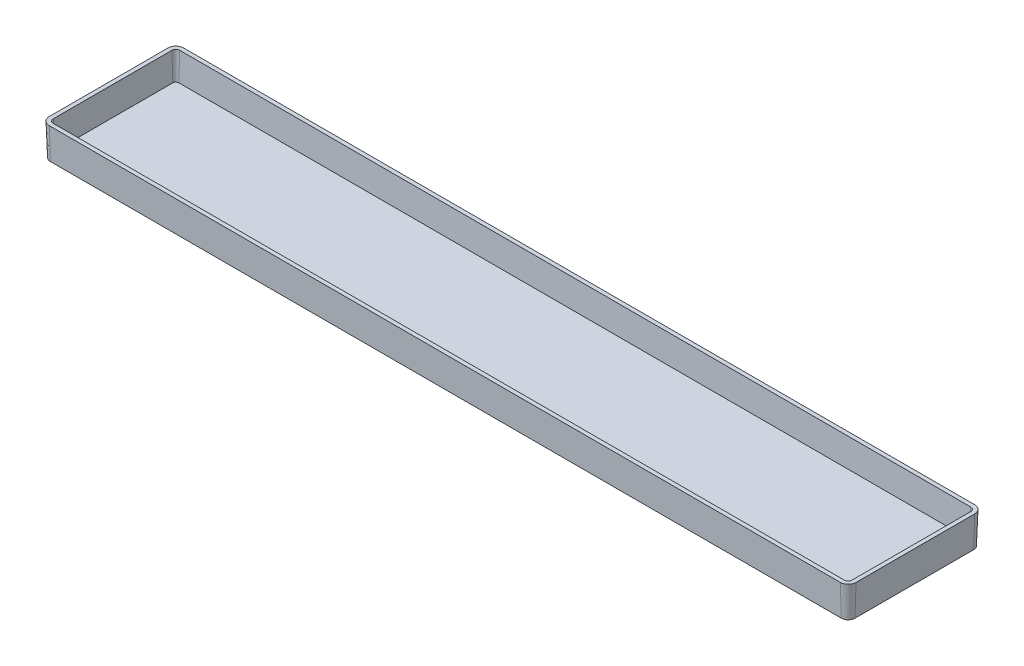
from build123d import *

# Parameters (mm, degrees)
BOSS_EXTRUDE1_DEPTH = 4
BOSS_EXTRUDE1_DRAFT = -2
SHELL1_T            = -0.5


with BuildPart() as part:
    # Sketch1 → Boss-Extrude1 (with draft: the straight prism first)
    with BuildSketch(Plane(origin=(0, 0, 0), x_dir=(1, 0, 0), z_dir=(0, 1, 0))):
        with BuildLine():
            Line((-50, -8.5), (50, -8.5))
            ThreePointArc((50, -8.5), (50.707106781, -8.207106781), (51, -7.5))
            Line((51, -7.5), (51, 7.5))
            ThreePointArc((51, 7.5), (50.707106781, 8.207106781), (50, 8.5))
            Line((50, 8.5), (-50, 8.5))
            ThreePointArc((-50, 8.5), (-50.707106781, 8.207106781), (-51, 7.5))
            Line((-51, 7.5), (-51, -7.5))
            ThreePointArc((-51, -7.5), (-50.707106781, -8.207106781), (-50, -8.5))
        make_face()
    extrude(amount=-BOSS_EXTRUDE1_DEPTH)
    # Boss-Extrude1: the draft: its side faces are tilted about the plane it starts from
    boss_extrude1_sides = [part.faces().sort_by_distance(p)[0] for p in [
        (0, -2, 8.5),
        (50.707106781, -2, 8.207106781),
        (51, -2, 0),
        (50.707106781, -2, -8.207106781),
        (0, -2, -8.5),
        (-50.707106781, -2, -8.207106781),
        (-51, -2, 0),
        (-50.707106781, -2, 8.207106781),
    ]]
    draft(boss_extrude1_sides, Plane(origin=(0, 0, 0), x_dir=(1, 0, 0), z_dir=(0, 1, 0)), BOSS_EXTRUDE1_DRAFT)

    # Shell1
    shell1_openings = [part.faces().sort_by_distance(p)[0] for p in [
        (0, 0, 0),
    ]]
    offset(amount=SHELL1_T, openings=shell1_openings, kind=Kind.INTERSECTION)


solid = part.part
